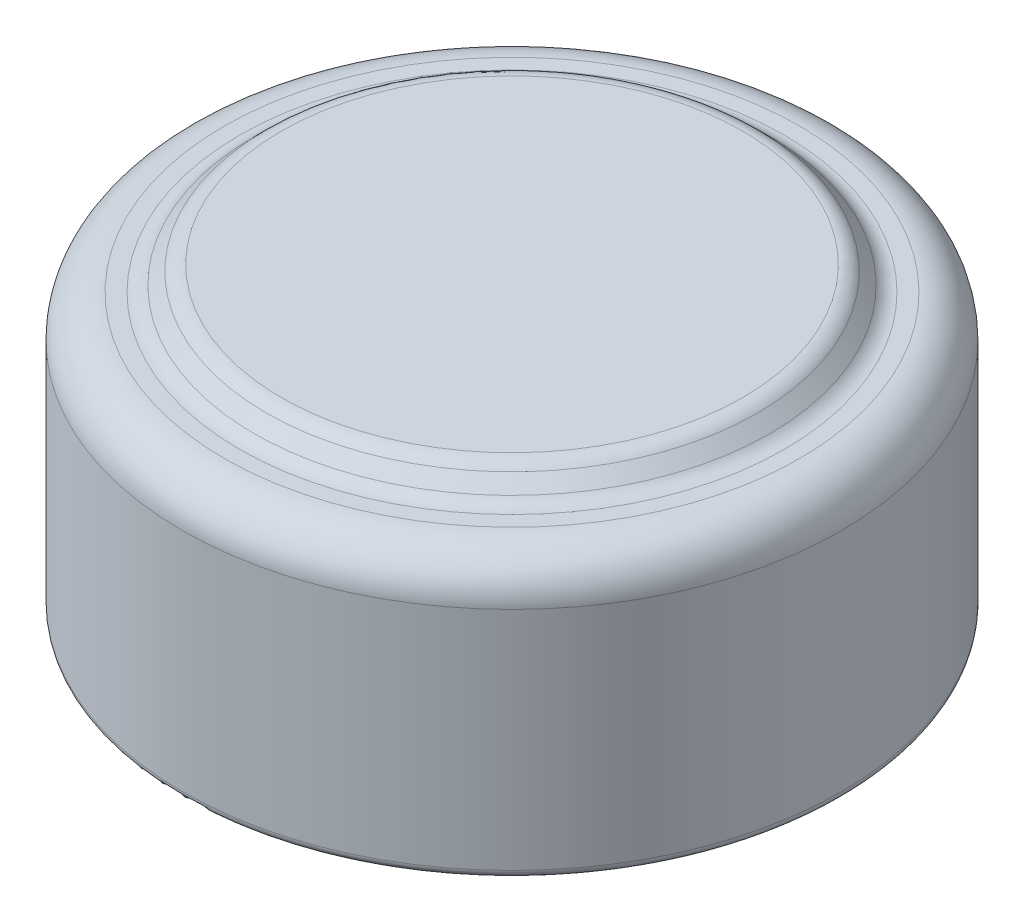
from build123d import *


with BuildPart() as part:
    # Sketch1 → Revolve1 (revolve)
    with BuildSketch(Plane.XY):
        with BuildLine():
            Line((0, 0), (-3.85, 0))
            ThreePointArc((-3.85, 0), (-3.920710678, 0.029289322), (-3.95, 0.1))
            Line((-3.95, 0.1), (-3.95, 2.81))
            ThreePointArc((-3.95, 2.81), (-3.803553391, 3.163553391), (-3.45, 3.31))
            Line((-3.45, 3.31), (-3.263553391, 3.31))
            ThreePointArc((-3.263553391, 3.31), (-3.167882533, 3.329030117), (-3.086776695, 3.383223305))
            Line((-3.086776695, 3.383223305), (-2.943223305, 3.526776695))
            ThreePointArc((-2.943223305, 3.526776695), (-2.862117467, 3.580969883), (-2.766446609, 3.6))
            Line((-2.766446609, 3.6), (0, 3.6))
            Line((0, 3.6), (0, 0))
        make_face()
    revolve(axis=Axis((0, 3.6, 0), (0, -1, 0)))


solid = part.part
